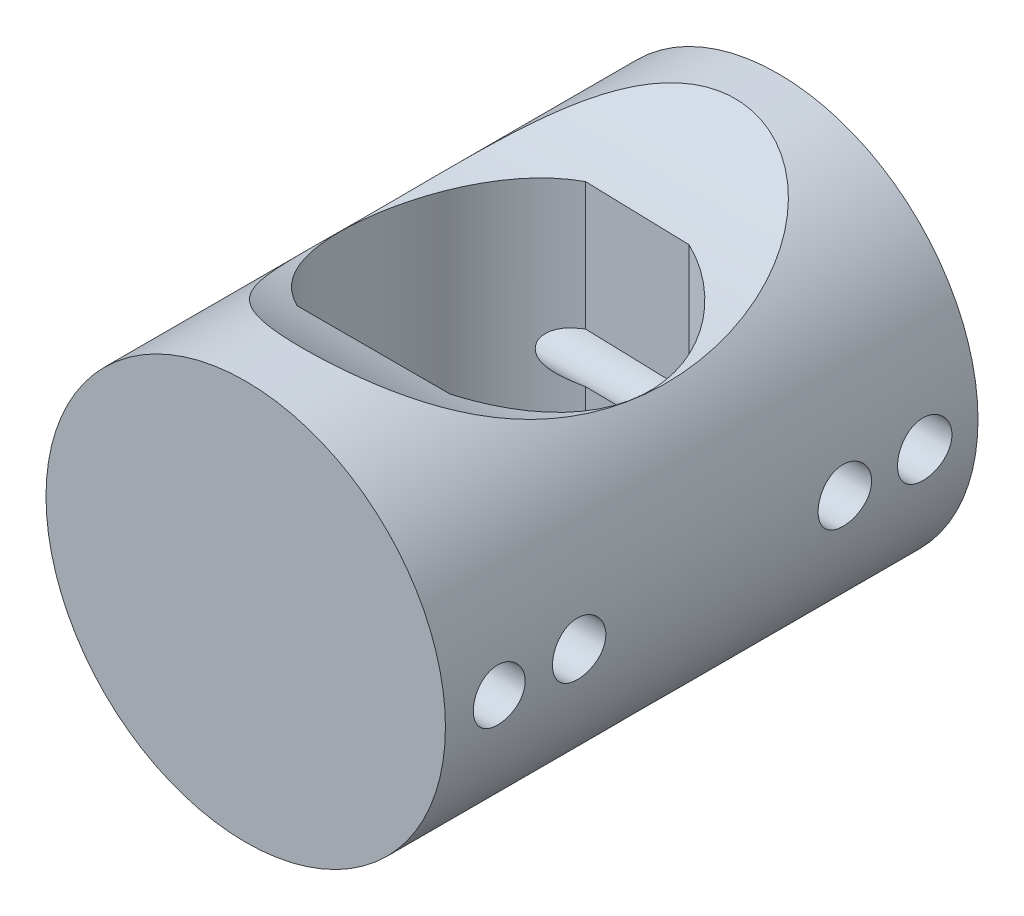
from build123d import *

# Parameters (mm, degrees)
SKETCH2_R               = 19.05
BOSS_EXTRUDE1_DEPTH     = 50.8
SKETCH3_R               = 2.593311049
SKETCH3_R_2             = 2.552831608
SKETCH3_R_3             = 2.477244579
SKETCH3_R_4             = 2.54595384
CUT_EXTRUDE1_DEPTH      = 67.295946332
CUT_EXTRUDE2_DEPTH      = 67.295946494
CUT_EXTRUDE3_DEPTH      = 58.501695782
CUT_EXTRUDE3_DEPTH_BACK = 58.501695782


with BuildPart() as part:
    # Sketch2 → Boss-Extrude1 (new body)
    with BuildSketch(Plane.XY):
        Circle(SKETCH2_R)
    extrude(amount=BOSS_EXTRUDE1_DEPTH)

    # Sketch3 → Cut-Extrude1 (cut, through all)
    with BuildSketch(Plane.ZY.offset(19.05)):
        with Locations((5.08, 0)):
            Circle(SKETCH3_R)
        with Locations((12.7, 0)):
            Circle(SKETCH3_R_2)
        with Locations((45.663499475, 0)):
            Circle(SKETCH3_R_3)
        with Locations((38.043499475, 0)):
            Circle(SKETCH3_R_4)
    extrude(amount=-CUT_EXTRUDE1_DEPTH, mode=Mode.SUBTRACT)

    # Sketch4 → Cut-Extrude2 (cut, through all)
    with BuildSketch(Plane.ZY.offset(19.05)):
        with BuildLine():
            Line((45.367449756, 19.05), (4.11234978, 19.05))
            ThreePointArc((4.11234978, 19.05), (24.739899768, 12.873839329), (45.367449756, 19.05))
        make_face()
    extrude(amount=-CUT_EXTRUDE2_DEPTH, mode=Mode.SUBTRACT)

    # Sketch5 → Cut-Extrude3 (cut, two sides: drawn at the far end of the back side and taken through both)
    with BuildSketch(Plane(origin=(0, 0, 0), x_dir=(1, 0, 0), z_dir=(0, 1, 0)).offset(-CUT_EXTRUDE3_DEPTH_BACK)):
        with BuildLine():
            ThreePointArc((13.941842258, -26.718871572), (11.587010676, -18.965411111), (5.317996426, -13.831130127))
            Line((5.317996426, -13.831130127), (-4.770355048, -13.618540345))
            ThreePointArc((-4.770355048, -13.618540345), (-13.870975191, -25.314943947), (-7.298575611, -38.597666106))
            Line((-7.298575611, -38.597666106), (7.298575611, -38.597666106))
            ThreePointArc((7.298575611, -38.597666106), (12.168207662, -33.523993748), (13.941842258, -26.718871572))
        make_face()
    extrude(amount=CUT_EXTRUDE3_DEPTH + CUT_EXTRUDE3_DEPTH_BACK, mode=Mode.SUBTRACT)


solid = part.part
